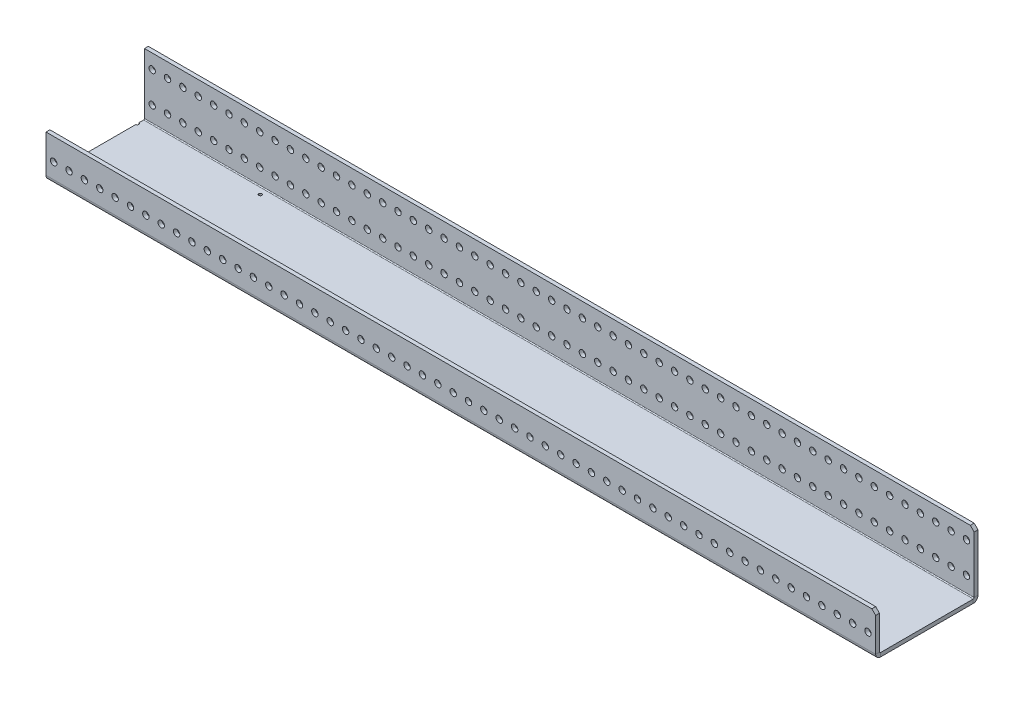
from build123d import *

# Parameters (mm, degrees)
SKETCH1_W                    = 787.4
SKETCH1_H                    = 78.232
BOSS_EXTRUDE1_DEPTH          = 3.175
EDGE_FLANGE1_STRIP_W         = 14.224
EDGE_FLANGE1_STRIP_H         = 3.175
EDGE_FLANGE1_STRIP_CUT_DEPTH = 787.4
EDGE_FLANGE1_DEPTH           = 787.4
EDGE_FLANGE2_STRIP_W         = 14.224
EDGE_FLANGE2_STRIP_H         = 3.175
EDGE_FLANGE2_STRIP_CUT_DEPTH = 787.4
EDGE_FLANGE2_DEPTH           = 787.4
SKETCH9_R                    = 2.667
CUT_EXTRUDE1_DEPTH           = 794.767078776
CHAMFER1_SIZE                = 3.175
LPATTERN1_COUNT              = 62
LPATTERN1_PITCH              = 12.7
SKETCH12_R                   = 1.27
CUT_EXTRUDE4_DEPTH           = 794.225377588
SKETCH14_R                   = 2.667
CUT_EXTRUDE6_DEPTH           = 5.08
LPATTERN4_COUNT              = 62
LPATTERN4_PITCH              = 12.7
CUT_EXTRUDE7_DEPTH           = 794.225377588
CUT_EXTRUDE7_DEPTH_BACK      = 794.225377588


# Sheet-metal steps are written as plain solids
with BuildPart() as part:
    # Sketch1 → Boss-Extrude1 (new body)
    with BuildSketch(Plane(origin=(0, 0, 0), x_dir=(1, 0, 0), z_dir=(0, 1, 0))):
        with Locations((393.7, 39.116)):
            Rectangle(SKETCH1_W, SKETCH1_H)
    extrude(amount=BOSS_EXTRUDE1_DEPTH)

    # Edge-Flange1 strip (across the edge) → Edge-Flange1 strip cut (cut)
    with BuildSketch(Plane(origin=(787.4, 3.175, -78.232), x_dir=(0, 0, 1), z_dir=(-1, 0, 0))):
        with Locations((-6.35, -1.5875)):
            Rectangle(EDGE_FLANGE1_STRIP_W, EDGE_FLANGE1_STRIP_H)
    extrude(amount=EDGE_FLANGE1_STRIP_CUT_DEPTH, mode=Mode.SUBTRACT)

    # Edge-Flange1 section (across the edge) → Edge-Flange1 (add)
    with BuildSketch(Plane(origin=(787.4, 3.175, -78.232), x_dir=(0, 0, 1), z_dir=(-1, 0, 0))):
        with BuildLine():
            Line((-3.175, 0.762), (-3.175, 50.8))
            Line((-3.175, 50.8), (0, 50.8))
            Line((0, 50.8), (0, 0.762))
            ThreePointArc((0, 0.762), (0.223184633, 0.223184633), (0.762, 0))
            Line((0.762, 0), (0.762, -3.175))
            ThreePointArc((0.762, -3.175), (-2.021879398, -2.021879398), (-3.175, 0.762))
        make_face()
    extrude(amount=EDGE_FLANGE1_DEPTH)

    # Edge-Flange2 strip (across the edge) → Edge-Flange2 strip cut (cut)
    with BuildSketch(Plane(origin=(0, 3.175, 0), x_dir=(0, 0, -1), z_dir=(1, 0, 0))):
        with Locations((-6.35, -1.5875)):
            Rectangle(EDGE_FLANGE2_STRIP_W, EDGE_FLANGE2_STRIP_H)
    extrude(amount=EDGE_FLANGE2_STRIP_CUT_DEPTH, mode=Mode.SUBTRACT)

    # Edge-Flange2 section (across the edge) → Edge-Flange2 (add)
    with BuildSketch(Plane(origin=(0, 3.175, 0), x_dir=(0, 0, -1), z_dir=(1, 0, 0))):
        with BuildLine():
            Line((-3.175, 0.762), (-3.175, 31.75))
            Line((-3.175, 31.75), (0, 31.75))
            Line((0, 31.75), (0, 0.762))
            ThreePointArc((0, 0.762), (0.223184633, 0.223184633), (0.762, 0))
            Line((0.762, 0), (0.762, -3.175))
            ThreePointArc((0.762, -3.175), (-2.021879398, -2.021879398), (-3.175, 0.762))
        make_face()
    extrude(amount=EDGE_FLANGE2_DEPTH)

    # Sketch9 → Cut-Extrude1 (cut, through all)
    with BuildSketch(Plane.XY.offset(3.175)):
        with Locations((781.05, 16.637)):
            Circle(SKETCH9_R)
    cut_extrude1 = extrude(amount=-CUT_EXTRUDE1_DEPTH, mode=Mode.SUBTRACT)

    # Chamfer1
    chamfer1_edges = [part.edges().sort_by_distance(p)[0] for p in [
        (787.4, 53.975, -79.8195),
        (0, 53.975, -79.8195),
        (0, 34.925, 1.5875),
        (787.4, 34.925, 1.5875),
    ]]
    chamfer(chamfer1_edges, length=CHAMFER1_SIZE)

    # LPattern1: Cut-Extrude1 ×62
    with Locations(*[(-i * LPATTERN1_PITCH, 0, 0) for i in range(1, LPATTERN1_COUNT)]):
        add(cut_extrude1, mode=Mode.SUBTRACT)

    # Sketch12 → Cut-Extrude4 (cut, through all)
    with BuildSketch(Plane(origin=(0, 3.175, 0), x_dir=(1, 0, 0), z_dir=(0, 1, 0))):
        with Locations(Location((101.6, 72.39, 0), (0, 0, 270))):
            Circle(SKETCH12_R)
        with Locations(Location((203.2, 72.39, 0), (0, 0, 270))):
            Circle(SKETCH12_R)
        with Locations(Location((203.2, 5.842, 0), (0, 0, 270))):
            Circle(SKETCH12_R)
        with Locations(Location((101.6, 5.842, 0), (0, 0, 270))):
            Circle(SKETCH12_R)
    extrude(amount=-CUT_EXTRUDE4_DEPTH, mode=Mode.SUBTRACT)

    # Sketch14 → Cut-Extrude6 (cut)
    with BuildSketch(Plane(origin=(0, 0, -81.407), x_dir=(-1, 0, 0), z_dir=(0, 0, -1))):
        with Locations(Location((-781.05, 42.037, 0), (0, 0, 90))):
            Circle(SKETCH14_R)
    cut_extrude6 = extrude(amount=-CUT_EXTRUDE6_DEPTH, mode=Mode.SUBTRACT)

    # LPattern4: Cut-Extrude6 ×62
    with Locations(*[(-i * LPATTERN4_PITCH, 0, 0) for i in range(1, LPATTERN4_COUNT)]):
        add(cut_extrude6, mode=Mode.SUBTRACT)

    # Sketch15 → Cut-Extrude7 (cut, two sides: drawn at the far end of the back side and taken through both)
    with BuildSketch(Plane(origin=(0, 3.175, 0), x_dir=(1, 0, 0), z_dir=(0, 1, 0)).offset(-CUT_EXTRUDE7_DEPTH_BACK)):
        Polygon((101.6, 5.842), (101.6, 72.39), (101.6, 81.407), (0, 81.407), (0, -3.175), (101.6, -3.175), align=None)
    extrude(amount=CUT_EXTRUDE7_DEPTH + CUT_EXTRUDE7_DEPTH_BACK, mode=Mode.SUBTRACT)


solid = part.part
